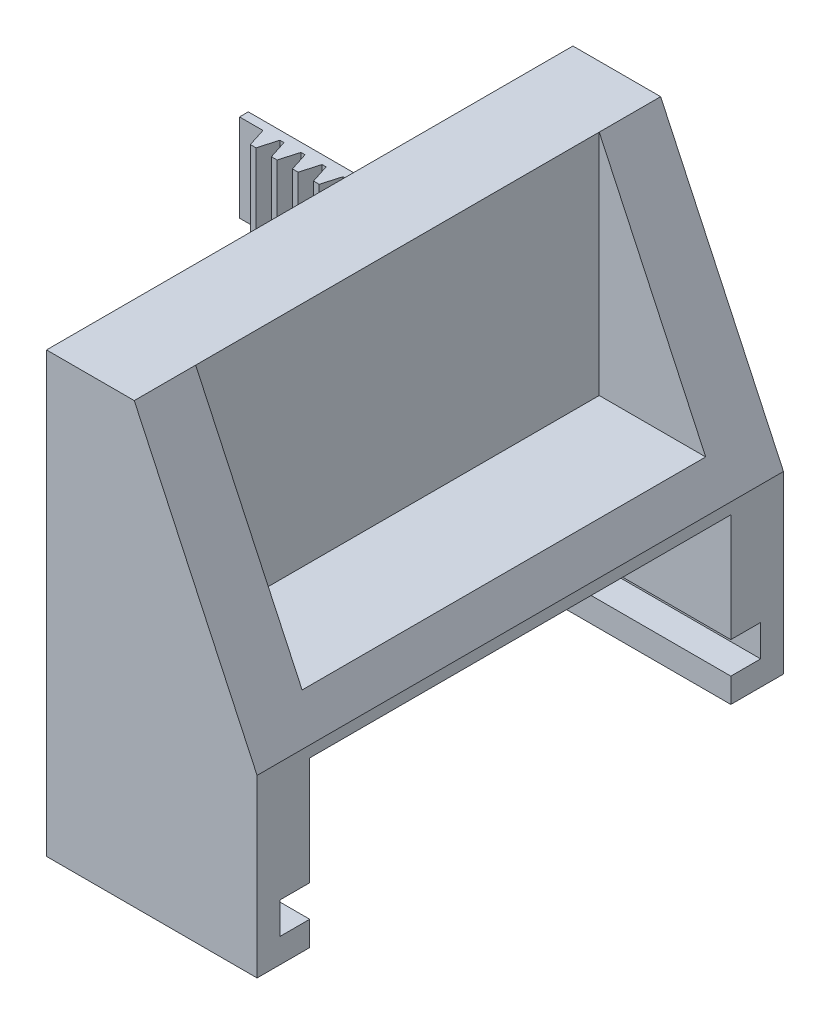
from build123d import *

# Parameters (mm, degrees)
BOSS_EXTRUDE1_DEPTH = 30
SKETCH4_W           = 24
SKETCH4_H           = 14
CUT_EXTRUDE2_DEPTH  = 25
SKETCH5_W           = 1.7
SKETCH5_H           = 1.8
CUT_EXTRUDE3_DEPTH  = 15
CUT_EXTRUDE4_DEPTH  = 11.5
BOSS_EXTRUDE2_DEPTH = 5


with BuildPart() as part:
    # Sketch1 → Boss-Extrude1 (new body)
    with BuildSketch(Plane.XY):
        Polygon((0, 0), (0, -25), (12, -25), (12, -15), (5, 0), align=None)
    extrude(amount=-BOSS_EXTRUDE1_DEPTH)

    # Sketch4 → Cut-Extrude2 (cut)
    with BuildSketch(Plane.ZY):
        with Locations((-15, -22.638599401)):
            Rectangle(SKETCH4_W, SKETCH4_H)
    extrude(amount=-CUT_EXTRUDE2_DEPTH, mode=Mode.SUBTRACT)

    # Sketch5 → Cut-Extrude3 (cut)
    with BuildSketch(Plane.ZY):
        with Locations((-2.15, -22.7)):
            Rectangle(SKETCH5_W, SKETCH5_H)
    cut_extrude3 = extrude(amount=-CUT_EXTRUDE3_DEPTH, mode=Mode.SUBTRACT)

    # Mirror1: Cut-Extrude3 across plane
    add(cut_extrude3.mirror(Plane.XY.offset(-15)), mode=Mode.SUBTRACT)

    # Sketch6 → Cut-Extrude4 (cut, symmetric)
    with BuildSketch(Plane.XY.offset(-15)):
        Polygon((5, 0), (5, -13), (11.066666667, -13), align=None)
    extrude(amount=CUT_EXTRUDE4_DEPTH, both=True, mode=Mode.SUBTRACT)

    # Sketch7 → Boss-Extrude2 (add)
    with BuildSketch(Plane(origin=(0, -15, 0), x_dir=(1, 0, 0), z_dir=(0, 1, 0))):
        Polygon((0, 27.5), (-16, 27.5), (-16, 27), (-14.9, 27), (-14.665549599, 27), (-14.327251213, 25.943471152), (-14.004330027, 25.943471152), (-13.7, 27), (-13.465549599, 27), (-13.127251213, 25.943471152), (-12.804330027, 25.943471152), (-12.5, 27), (-12.265549599, 27), (-11.927251213, 25.943471152), (-11.604330027, 25.943471152), (-11.3, 27), (-11.065549599, 27), (-10.727251213, 25.943471152), (-10.404330027, 25.943471152), (-10.1, 27), (-9.865549599, 27), (-9.527251213, 25.943471152), (-9.204330027, 25.943471152), (-8.9, 27), (-8.665549599, 27), (-8.327251213, 25.943471152), (-8.004330027, 25.943471152), (-7.7, 27), (-7.465549599, 27), (-7.127251213, 25.943471152), (-6.804330027, 25.943471152), (-6.5, 27), (-6.265549599, 27), (-5.927251213, 25.943471152), (-5.604330027, 25.943471152), (-5.3, 27), (-5.065549599, 27), (-4.727251213, 25.943471152), (-4.404330027, 25.943471152), (-4.1, 27), (-3.865549599, 27), (-3.527251213, 25.943471152), (-3.204330027, 25.943471152), (-2.9, 27), (-2.665549599, 27), (-2.327251213, 25.943471152), (-2.004330027, 25.943471152), (-1.7, 27), (-1.465549599, 27), (-1.127251213, 25.943471152), (-0.804330027, 25.943471152), (-0.5, 27), (0, 27), align=None)
    extrude(amount=BOSS_EXTRUDE2_DEPTH)


solid = part.part
